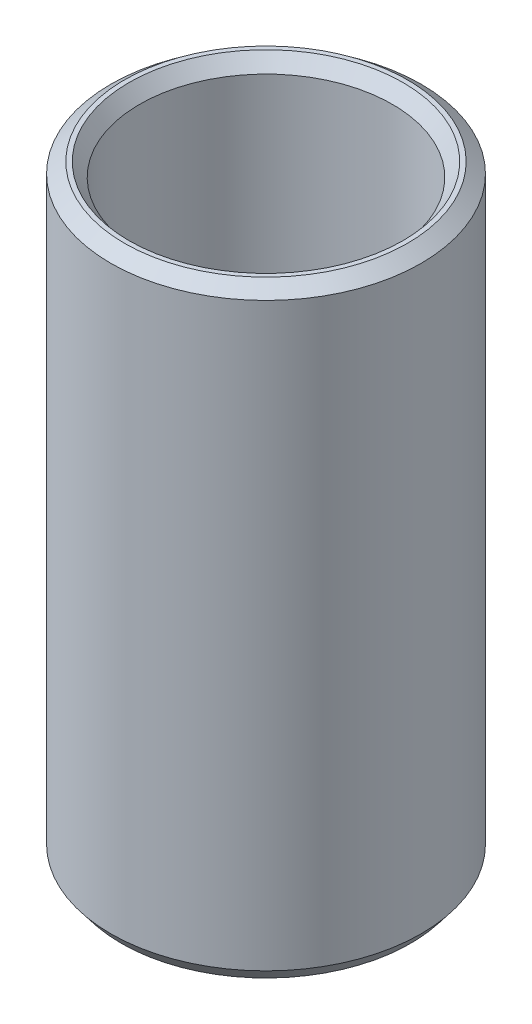
from build123d import *
from OCP.BRepFilletAPI import BRepFilletAPI_MakeChamfer

# Parameters (mm, degrees)
SKETCH1_R           = 45
BOSS_EXTRUDE1_DEPTH = 175.367665251
SKETCH2_R           = 36.669582055
CUT_EXTRUDE1_DEPTH  = 187.557814137
CHAMFER1_SIZE       = 3.056400948
CHAMFER1_SIZE2      = 3.951507141


with BuildPart() as part:
    # Sketch1 → Boss-Extrude1 (new body)
    with BuildSketch(Plane(origin=(0, 0, 0), x_dir=(1, 0, 0), z_dir=(0, 1, 0))):
        Circle(SKETCH1_R)
    extrude(amount=BOSS_EXTRUDE1_DEPTH)

    # Sketch2 → Cut-Extrude1 (cut, through all)
    with BuildSketch(Plane(origin=(0, 0, 0), x_dir=(1, 0, 0), z_dir=(0, 1, 0))):
        Circle(SKETCH2_R)
    extrude(amount=CUT_EXTRUDE1_DEPTH, mode=Mode.SUBTRACT)

    # Chamfer1: one chamfer whose edges measure the first distance from different faces: ONE call of the kernel's chamfer builder (chamfer() names one face for all edges)
    chamfer1_edges_1 = [part.edges().sort_by_distance(p)[0] for p in [
        (-36.669582055, 175.367665251, 0),
    ]]
    chamfer1_side_1 = [part.faces().sort_by_distance(p)[0] for p in [
        (-43.727207794, 175.367665251, 0),
    ]]
    chamfer1_edges_2 = [part.edges().sort_by_distance(p)[0] for p in [
        (-36.669582055, 0, 0),
    ]]
    chamfer1_side_2 = [part.faces().sort_by_distance(p)[0] for p in [
        (-36.669582055, 87.683832625, 0),
    ]]
    chamfer1_edges_3 = [part.edges().sort_by_distance(p)[0] for p in [
        (-45, 0, 0),
    ]]
    chamfer1_side_3 = [part.faces().sort_by_distance(p)[0] for p in [
        (-43.727207794, 0, 0),
    ]]
    chamfer1_edges_4 = [part.edges().sort_by_distance(p)[0] for p in [
        (-45, 175.367665251, 0),
    ]]
    chamfer1_side_4 = [part.faces().sort_by_distance(p)[0] for p in [
        (-45, 87.683832625, 0),
    ]]
    chamfer1 = BRepFilletAPI_MakeChamfer(part.part.solid().wrapped)
    for e in chamfer1_edges_1:
        chamfer1.Add(CHAMFER1_SIZE, CHAMFER1_SIZE2, e.wrapped, chamfer1_side_1[0].wrapped)  # the first distance lies on this face
    for e in chamfer1_edges_2:
        chamfer1.Add(CHAMFER1_SIZE, CHAMFER1_SIZE2, e.wrapped, chamfer1_side_2[0].wrapped)  # the first distance lies on this face
    for e in chamfer1_edges_3:
        chamfer1.Add(CHAMFER1_SIZE, CHAMFER1_SIZE2, e.wrapped, chamfer1_side_3[0].wrapped)  # the first distance lies on this face
    for e in chamfer1_edges_4:
        chamfer1.Add(CHAMFER1_SIZE, CHAMFER1_SIZE2, e.wrapped, chamfer1_side_4[0].wrapped)  # the first distance lies on this face
    add(Compound.cast(chamfer1.Shape()), mode=Mode.REPLACE)


solid = part.part
